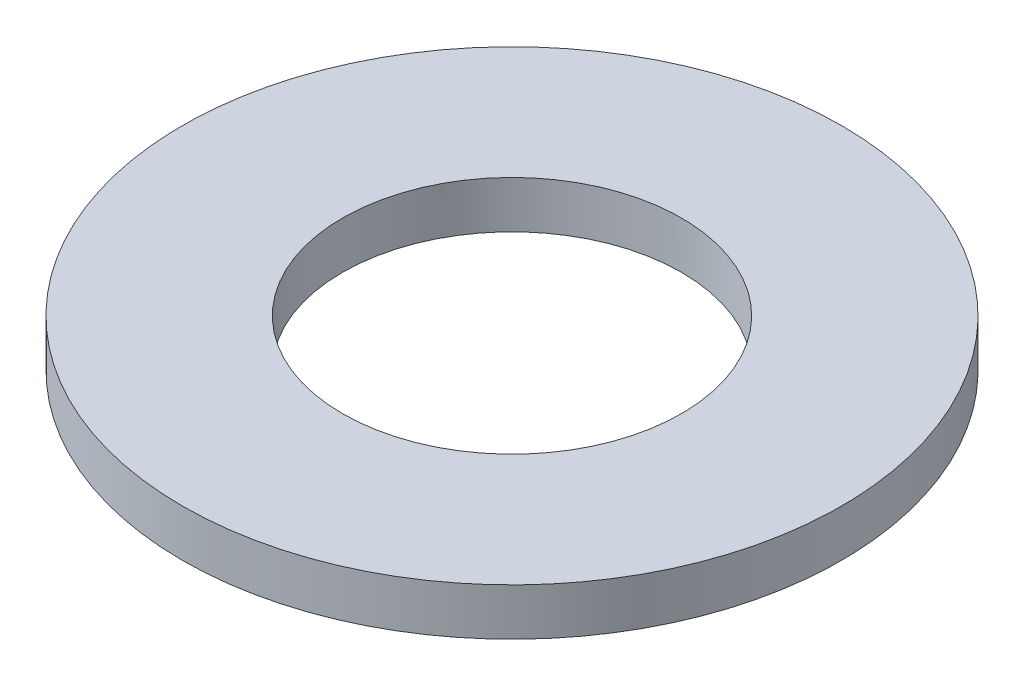
from build123d import *

# Parameters (mm, degrees)
SKETCH1_R               = 1750
BOSS_EXTRUDE1_DEPTH     = 500
SKETCH2_R               = 900
CUT_EXTRUDE2_DEPTH      = 300
SKETCH3_R               = 600
CUT_EXTRUDE3_DEPTH      = 300
SKETCH4_R               = 1700
SKETCH4_R_2             = 950
CUT_EXTRUDE5_DEPTH      = 490
CUT_EXTRUDE6_DEPTH      = 2525.876234591
CUT_EXTRUDE6_DEPTH_BACK = 2525.876234591
SKETCH5_W               = 3500
SKETCH5_H               = 250


with BuildPart() as part:
    # Sketch1 → Boss-Extrude1 (new body)
    with BuildSketch(Plane(origin=(0, 0, 0), x_dir=(1, 0, 0), z_dir=(0, 1, 0))):
        Circle(SKETCH1_R)
    extrude(amount=BOSS_EXTRUDE1_DEPTH)

    # Sketch2 → Cut-Extrude2 (cut)
    with BuildSketch(Plane(origin=(0, 500, 0), x_dir=(1, 0, 0), z_dir=(0, 1, 0))):
        Circle(SKETCH2_R)
    extrude(amount=-CUT_EXTRUDE2_DEPTH, mode=Mode.SUBTRACT)

    # Sketch3 → Cut-Extrude3 (cut)
    with BuildSketch(Plane.XZ):
        Circle(SKETCH3_R)
    extrude(amount=-CUT_EXTRUDE3_DEPTH, mode=Mode.SUBTRACT)

    # Sketch4 → Cut-Extrude5 (cut)
    with BuildSketch(Plane(origin=(0, 0, 0), x_dir=(-1, 0, 0), z_dir=(0, -1, 0))):
        Circle(SKETCH4_R)
        Circle(SKETCH4_R_2, mode=Mode.SUBTRACT)
    extrude(amount=-CUT_EXTRUDE5_DEPTH, mode=Mode.SUBTRACT)

    # Sketch5 → Cut-Extrude6 (cut, two sides: drawn at the far end of the back side and taken through both)
    with BuildSketch(Plane.XY.offset(-CUT_EXTRUDE6_DEPTH_BACK)):
        with Locations((0, 125)):
            Rectangle(SKETCH5_W, SKETCH5_H)
    extrude(amount=CUT_EXTRUDE6_DEPTH + CUT_EXTRUDE6_DEPTH_BACK, mode=Mode.SUBTRACT)


solid = part.part
